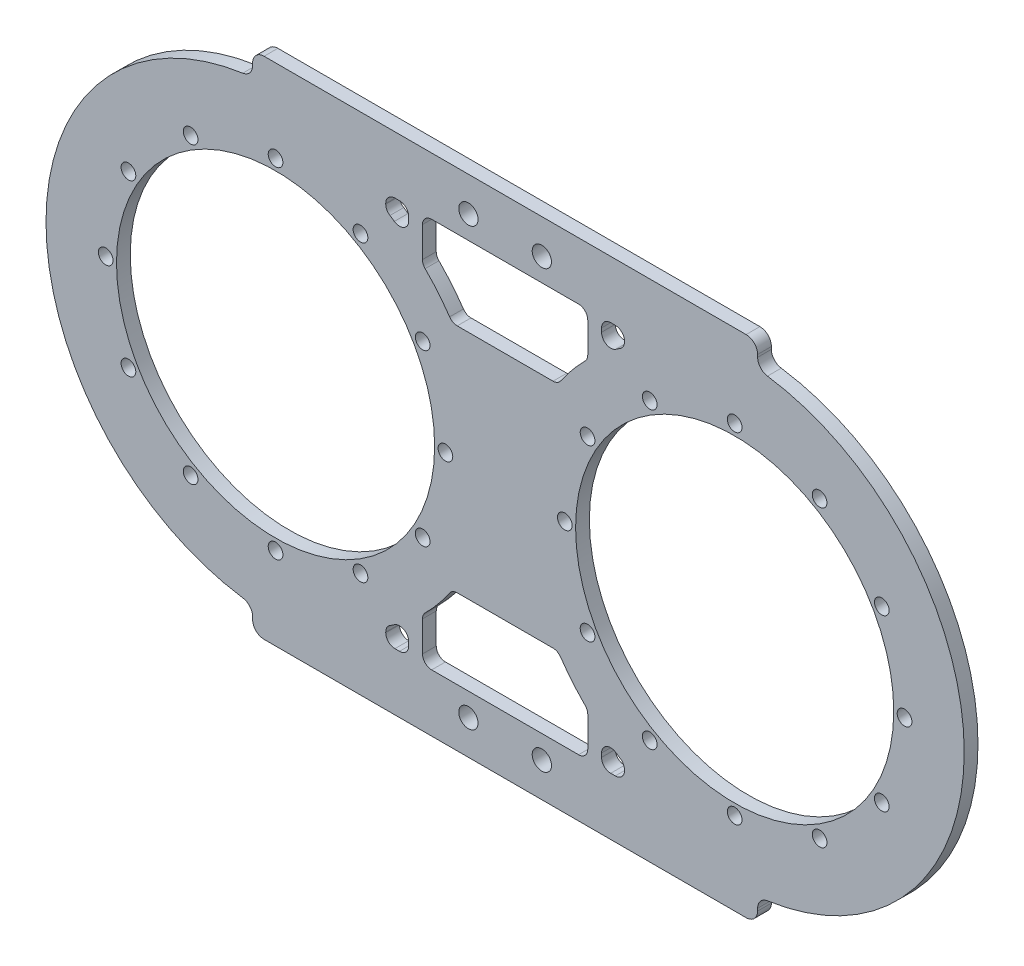
from build123d import *

# Parameters (mm, degrees)
SKETCH_1_R          = 34.65
SKETCH_1_R_2        = 1.6
SKETCH_1_R_3        = 2.1
EXTRUDE_1_DEPTH     = 3
FILLET_1_R          = 2.5
CUT_EXTRUDE_1_DEPTH = 10
FILLET_2_R          = 2


with BuildPart() as part:
    # 草图1 → 凸台-拉伸1 (new body)
    with BuildSketch(Plane.XY):
        with BuildLine():
            Line((55, 55), (55, 49.749371855))
            ThreePointArc((55, 49.749371855), (100, 0), (55, -49.749371855))
            Line((55, -49.749371855), (55, -55))
            Line((55, -55), (-55, -55))
            Line((-55, -55), (-55, -49.749371855))
            ThreePointArc((-55, -49.749371855), (-100, 0), (-55, 49.749371855))
            Line((-55, 49.749371855), (-55, 55))
            Line((-55, 55), (55, 55))
        make_face()
        with Locations((-50, 0)):
            Circle(SKETCH_1_R, mode=Mode.SUBTRACT)
        with Locations((50, 0)):
            Circle(SKETCH_1_R, mode=Mode.SUBTRACT)
        with Locations((-50, 37)):
            Circle(SKETCH_1_R_2, mode=Mode.SUBTRACT)
        with Locations((-31.5, 32.04293994)):
            Circle(SKETCH_1_R_2, mode=Mode.SUBTRACT)
        with Locations((-17.95706006, 18.5)):
            Circle(SKETCH_1_R_2, mode=Mode.SUBTRACT)
        with Locations((-13, 0)):
            Circle(SKETCH_1_R_2, mode=Mode.SUBTRACT)
        with Locations((-17.95706006, -18.5)):
            Circle(SKETCH_1_R_2, mode=Mode.SUBTRACT)
        with Locations((-31.5, -32.04293994)):
            Circle(SKETCH_1_R_2, mode=Mode.SUBTRACT)
        with Locations((-50, -37)):
            Circle(SKETCH_1_R_2, mode=Mode.SUBTRACT)
        with Locations((-68.5, -32.04293994)):
            Circle(SKETCH_1_R_2, mode=Mode.SUBTRACT)
        with Locations((-82.04293994, -18.5)):
            Circle(SKETCH_1_R_2, mode=Mode.SUBTRACT)
        with Locations((-87, 0)):
            Circle(SKETCH_1_R_2, mode=Mode.SUBTRACT)
        with Locations((-82.04293994, 18.5)):
            Circle(SKETCH_1_R_2, mode=Mode.SUBTRACT)
        with Locations((-68.5, 32.04293994)):
            Circle(SKETCH_1_R_2, mode=Mode.SUBTRACT)
        with Locations((68.5, 32.04293994)):
            Circle(SKETCH_1_R_2, mode=Mode.SUBTRACT)
        with Locations((50, 37)):
            Circle(SKETCH_1_R_2, mode=Mode.SUBTRACT)
        with Locations((31.5, 32.04293994)):
            Circle(SKETCH_1_R_2, mode=Mode.SUBTRACT)
        with Locations((17.95706006, 18.5)):
            Circle(SKETCH_1_R_2, mode=Mode.SUBTRACT)
        with Locations((13, 0)):
            Circle(SKETCH_1_R_2, mode=Mode.SUBTRACT)
        with Locations((17.95706006, -18.5)):
            Circle(SKETCH_1_R_2, mode=Mode.SUBTRACT)
        with Locations((31.5, -32.04293994)):
            Circle(SKETCH_1_R_2, mode=Mode.SUBTRACT)
        with Locations((50, -37)):
            Circle(SKETCH_1_R_2, mode=Mode.SUBTRACT)
        with Locations((68.5, -32.04293994)):
            Circle(SKETCH_1_R_2, mode=Mode.SUBTRACT)
        with Locations((82.04293994, -18.5)):
            Circle(SKETCH_1_R_2, mode=Mode.SUBTRACT)
        with Locations((87, 0)):
            Circle(SKETCH_1_R_2, mode=Mode.SUBTRACT)
        with Locations((82.04293994, 18.5)):
            Circle(SKETCH_1_R_2, mode=Mode.SUBTRACT)
        with Locations((-8, 47.5)):
            Circle(SKETCH_1_R_3, mode=Mode.SUBTRACT)
        with Locations((8, 47.5)):
            Circle(SKETCH_1_R_3, mode=Mode.SUBTRACT)
        with Locations((8, -47.5)):
            Circle(SKETCH_1_R_3, mode=Mode.SUBTRACT)
        with Locations((-8, -47.5)):
            Circle(SKETCH_1_R_3, mode=Mode.SUBTRACT)
    extrude(amount=EXTRUDE_1_DEPTH)

    # 圆角1
    fillet_1_edges = [part.edges().sort_by_distance(p)[0] for p in [
        (-55, 55, 1.5),
        (-55, 49.749371855, 1.5),
        (-55, -55, 1.5),
        (-55, -49.749371855, 1.5),
        (55, -49.749371855, 1.5),
        (55, -55, 1.5),
        (55, 55, 1.5),
        (55, 49.749371855, 1.5),
    ]]
    fillet(fillet_1_edges, radius=FILLET_1_R)

    # 草图2 → 切除-拉伸1 (cut)
    with BuildSketch(Plane.XY):
        with BuildLine():
            Line((18, 42.5), (18, 33.045423284))
            ThreePointArc((18, 33.045423284), (14.531406471, 29.291276399), (11.500718656, 25.175490779))
            Line((11.500718656, 25.175490779), (-11.500718656, 25.175490779))
            ThreePointArc((-11.500718656, 25.175490779), (-14.531406471, 29.291276399), (-18, 33.045423284))
            Line((-18, 33.045423284), (-18, 42.5))
            Line((-18, 42.5), (18, 42.5))
        make_face()
        with BuildLine():
            Line((-21, 42.5), (-21, 35.707142143))
            ThreePointArc((-21, 35.707142143), (-23.441097937, 37.558284322), (-26, 39.242833741))
            Line((-26, 39.242833741), (-26, 42.5))
            Line((-26, 42.5), (-21, 42.5))
        make_face()
        with BuildLine():
            Line((-26, -42.5), (-26, -39.242833741))
            ThreePointArc((-26, -39.242833741), (-23.441097937, -37.558284322), (-21, -35.707142143))
            Line((-21, -35.707142143), (-21, -42.5))
            Line((-21, -42.5), (-26, -42.5))
        make_face()
        with BuildLine():
            Line((-18, -42.5), (-18, -33.045423284))
            ThreePointArc((-18, -33.045423284), (-14.531406471, -29.291276399), (-11.500718656, -25.175490779))
            Line((-11.500718656, -25.175490779), (11.500718656, -25.175490779))
            ThreePointArc((11.500718656, -25.175490779), (14.531406471, -29.291276399), (18, -33.045423284))
            Line((18, -33.045423284), (18, -42.5))
            Line((18, -42.5), (-18, -42.5))
        make_face()
        with BuildLine():
            Line((21, -42.5), (21, -35.707142143))
            ThreePointArc((21, -35.707142143), (23.441097937, -37.558284322), (26, -39.242833741))
            Line((26, -39.242833741), (26, -42.5))
            Line((26, -42.5), (21, -42.5))
        make_face()
        with BuildLine():
            Line((26, 42.5), (26, 39.242833741))
            ThreePointArc((26, 39.242833741), (23.441097937, 37.558284322), (21, 35.707142143))
            Line((21, 35.707142143), (21, 42.5))
            Line((21, 42.5), (26, 42.5))
        make_face()
    extrude(amount=CUT_EXTRUDE_1_DEPTH, mode=Mode.SUBTRACT)

    # 圆角2
    fillet_2_edges = [part.edges().sort_by_distance(p)[0] for p in [
        (-18, -42.5, 1.5),
        (-11.500718656, -25.175490779, 1.5),
        (-18, -33.045423284, 1.5),
        (-21, -42.5, 1.5),
        (-26, -42.5, 1.5),
        (-21, -35.707142143, 1.5),
        (-26, -39.242833741, 1.5),
        (18, 33.045423284, 1.5),
        (11.500718656, 25.175490779, 1.5),
        (18, 42.5, 1.5),
        (-21, 35.707142143, 1.5),
        (-18, 42.5, 1.5),
        (-21, 42.5, 1.5),
        (-26, 42.5, 1.5),
        (-26, 39.242833741, 1.5),
        (-11.500718656, 25.175490779, 1.5),
        (-18, 33.045423284, 1.5),
        (11.500718656, -25.175490779, 1.5),
        (18, -33.045423284, 1.5),
        (18, -42.5, 1.5),
        (26, -42.5, 1.5),
        (26, -39.242833741, 1.5),
        (21, -35.707142143, 1.5),
        (21, -42.5, 1.5),
        (26, 42.5, 1.5),
        (26, 39.242833741, 1.5),
        (21, 35.707142143, 1.5),
        (21, 42.5, 1.5),
    ]]
    fillet(fillet_2_edges, radius=FILLET_2_R)


solid = part.part
